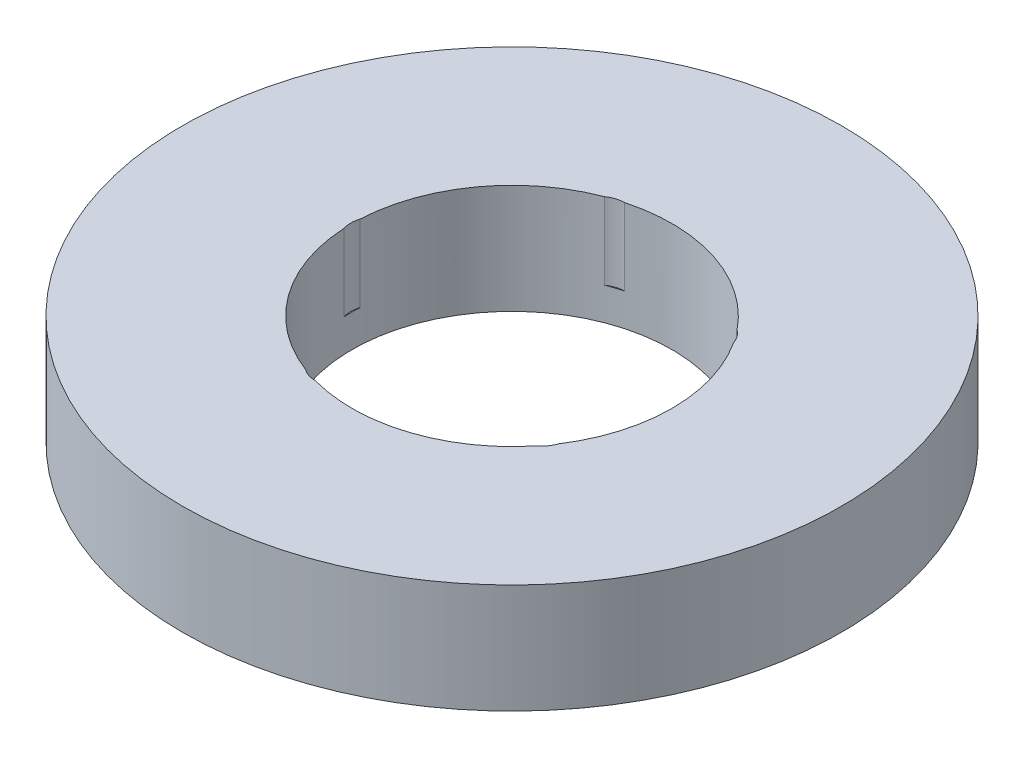
from build123d import *

# Parameters (mm, degrees)
SKETCH1_R           = 87.5
BOSS_EXTRUDE1_DEPTH = 29
SKETCH2_R           = 42.5
CUT_EXTRUDE1_DEPTH  = 128.096420091
SKETCH3_R           = 6.994164165
CUT_EXTRUDE2_DEPTH  = 20.357613701
CIRPATTERN1_COUNT   = 5


with BuildPart() as part:
    # Sketch1 → Boss-Extrude1 (new body)
    with BuildSketch(Plane(origin=(0, 0, 0), x_dir=(1, 0, 0), z_dir=(0, 1, 0))):
        Circle(SKETCH1_R)
    extrude(amount=BOSS_EXTRUDE1_DEPTH)

    # Sketch2 → Cut-Extrude1 (cut, through all)
    with BuildSketch(Plane(origin=(0, 0, 0), x_dir=(1, 0, 0), z_dir=(0, 1, 0))):
        Circle(SKETCH2_R)
    extrude(amount=CUT_EXTRUDE1_DEPTH, mode=Mode.SUBTRACT)

    # Sketch3 → Cut-Extrude2 (cut)
    with BuildSketch(Plane(origin=(0, 29, 0), x_dir=(1, 0, 0), z_dir=(0, 1, 0))):
        with Locations((-35.782905188, 0)):
            Circle(SKETCH3_R)
    cut_extrude2 = extrude(amount=-CUT_EXTRUDE2_DEPTH, mode=Mode.SUBTRACT)

    # CirPattern1: Cut-Extrude2 ×5 about axis
    cirpattern1_axis = Axis((0, 0, 0), (0, 1, 0))
    for i in range(1, CIRPATTERN1_COUNT):
        add(cut_extrude2.rotate(cirpattern1_axis, i * 360 / CIRPATTERN1_COUNT), mode=Mode.SUBTRACT)


solid = part.part
